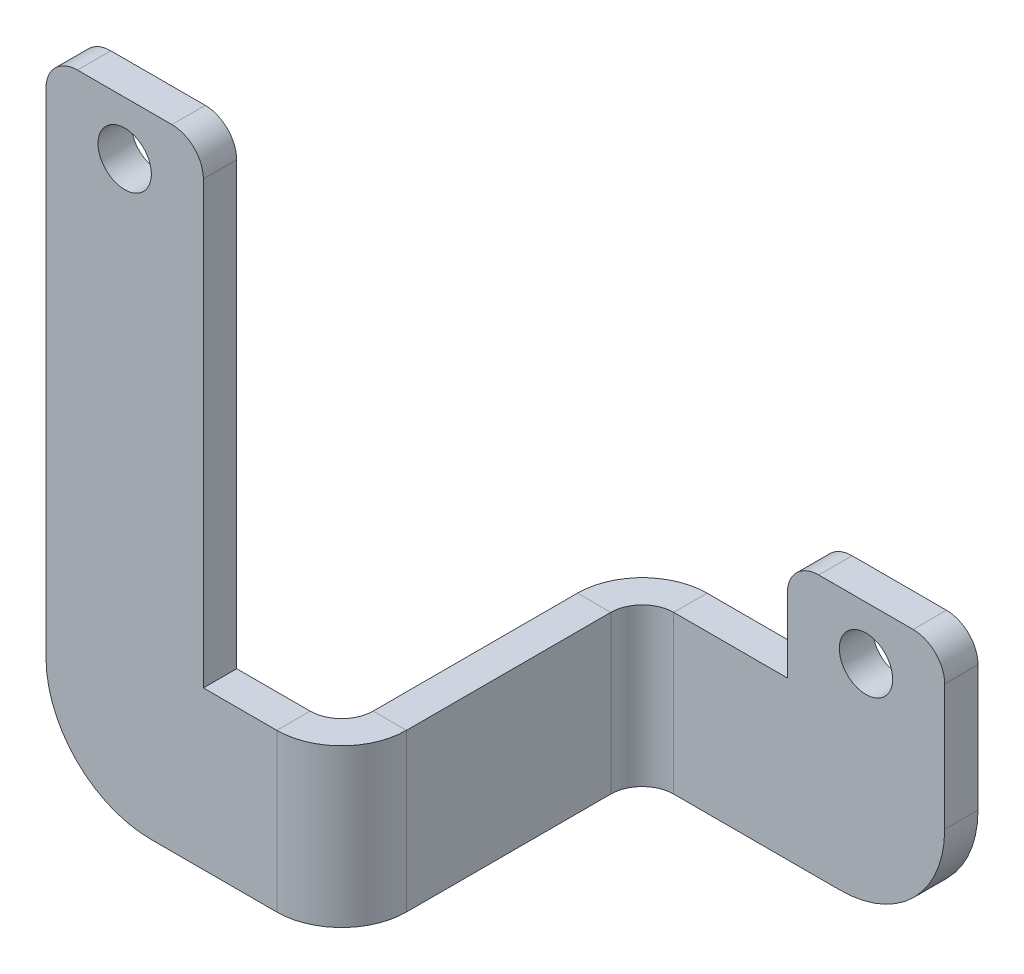
from build123d import *

# Parameters (mm, degrees)
SKETCH1_W                    = 25
SKETCH1_H                    = 15
BASE_FLANGE1_DEPTH           = 3.175
EDGE_FLANGE1_STRIP_W         = 18.7
EDGE_FLANGE1_STRIP_H         = 3.175
EDGE_FLANGE1_STRIP_CUT_DEPTH = 15
EDGE_FLANGE1_DEPTH           = 15
EDGE_FLANGE2_STRIP_W         = 18.7
EDGE_FLANGE2_STRIP_H         = 3.175
EDGE_FLANGE2_STRIP_CUT_DEPTH = 15
EDGE_FLANGE2_DEPTH           = 15
SKETCH12_W                   = 15
SKETCH12_H                   = 3.175
BOSS_EXTRUDE1_DEPTH          = 45
SKETCH15_R                   = 2.54
CUT_EXTRUDE2_DEPTH           = 75.547451331
SKETCH19_W                   = 15
SKETCH19_H                   = 3.175
BOSS_EXTRUDE2_DEPTH          = 10
SKETCH21_R                   = 2.54
CUT_EXTRUDE3_DEPTH           = 76.824340584
FILLET2_R                    = 3
FILLET3_R                    = 10


# Sheet-metal steps are written as plain solids
with BuildPart() as part:
    # Sketch1 → Base-Flange1 (new body)
    with BuildSketch(Plane.XY):
        Rectangle(SKETCH1_W, SKETCH1_H)
    extrude(amount=-BASE_FLANGE1_DEPTH)

    # Edge-Flange1 strip (across the edge) → Edge-Flange1 strip cut (cut)
    with BuildSketch(Plane(origin=(12.5, 7.5, -3.175), x_dir=(-1, 0, 0), z_dir=(0, -1, 0))):
        with Locations((-6.35, -1.5875)):
            Rectangle(EDGE_FLANGE1_STRIP_W, EDGE_FLANGE1_STRIP_H)
    extrude(amount=EDGE_FLANGE1_STRIP_CUT_DEPTH, mode=Mode.SUBTRACT)

    # Edge-Flange1 section (across the edge) → Edge-Flange1 (add)
    with BuildSketch(Plane(origin=(12.5, 7.5, -3.175), x_dir=(-1, 0, 0), z_dir=(0, -1, 0))):
        with BuildLine():
            Line((-3.175, 3), (-3.175, 25.475))
            Line((-3.175, 25.475), (0, 25.475))
            Line((0, 25.475), (0, 3))
            ThreePointArc((0, 3), (0.878679656, 0.878679656), (3, 0))
            Line((3, 0), (3, -3.175))
            ThreePointArc((3, -3.175), (-1.366384374, -1.366384374), (-3.175, 3))
        make_face()
    extrude(amount=EDGE_FLANGE1_DEPTH)

    # Edge-Flange2 strip (across the edge) → Edge-Flange2 strip cut (cut)
    with BuildSketch(Plane(origin=(15.675, -7.5, -28.65), x_dir=(0, 0, 1), z_dir=(0, 1, 0))):
        with Locations((-6.35, -1.5875)):
            Rectangle(EDGE_FLANGE2_STRIP_W, EDGE_FLANGE2_STRIP_H)
    extrude(amount=EDGE_FLANGE2_STRIP_CUT_DEPTH, mode=Mode.SUBTRACT)

    # Edge-Flange2 section (across the edge) → Edge-Flange2 (add)
    with BuildSketch(Plane(origin=(15.675, -7.5, -28.65), x_dir=(0, 0, 1), z_dir=(0, 1, 0))):
        with BuildLine():
            Line((-3.175, 3), (-3.175, 28.825))
            Line((-3.175, 28.825), (0, 28.825))
            Line((0, 28.825), (0, 3))
            ThreePointArc((0, 3), (0.878679656, 0.878679656), (3, 0))
            Line((3, 0), (3, -3.175))
            ThreePointArc((3, -3.175), (-1.366384374, -1.366384374), (-3.175, 3))
        make_face()
    extrude(amount=EDGE_FLANGE2_DEPTH)

    # Sketch12 → Boss-Extrude1 (add)
    with BuildSketch(Plane(origin=(0, 7.5, 0), x_dir=(1, 0, 0), z_dir=(0, 1, 0))):
        with Locations((-5, 1.5875)):
            Rectangle(SKETCH12_W, SKETCH12_H)
    extrude(amount=BOSS_EXTRUDE1_DEPTH)

    # Sketch15 → Cut-Extrude2 (cut, through all)
    with BuildSketch(Plane(origin=(0, 0, -3.175), x_dir=(-1, 0, 0), z_dir=(0, 0, -1))):
        with Locations((5, 47.42)):
            Circle(SKETCH15_R)
    extrude(amount=-CUT_EXTRUDE2_DEPTH, mode=Mode.SUBTRACT)

    # Sketch19 → Boss-Extrude2 (add)
    with BuildSketch(Plane(origin=(0, 7.5, 0), x_dir=(1, 0, 0), z_dir=(0, 1, 0))):
        with Locations((37, 30.2375)):
            Rectangle(SKETCH19_W, SKETCH19_H)
    extrude(amount=BOSS_EXTRUDE2_DEPTH)

    # Sketch21 → Cut-Extrude3 (cut, through all)
    with BuildSketch(Plane(origin=(0, 0, -31.825), x_dir=(-1, 0, 0), z_dir=(0, 0, -1))):
        with Locations((-37, 12.42)):
            Circle(SKETCH21_R)
    extrude(amount=-CUT_EXTRUDE3_DEPTH, mode=Mode.SUBTRACT)

    # Fillet2
    fillet2_edges = [part.edges().sort_by_distance(p)[0] for p in [
        (44.5, 17.5, -30.2375),
        (29.5, 17.5, -30.2375),
        (-12.5, 52.5, -1.5875),
        (2.5, 52.5, -1.5875),
    ]]
    fillet(fillet2_edges, radius=FILLET2_R)

    # Fillet3
    fillet3_edges = [part.edges().sort_by_distance(p)[0] for p in [
        (44.5, -7.5, -30.2375),
        (-12.5, -7.5, -1.5875),
    ]]
    fillet(fillet3_edges, radius=FILLET3_R)


solid = part.part
